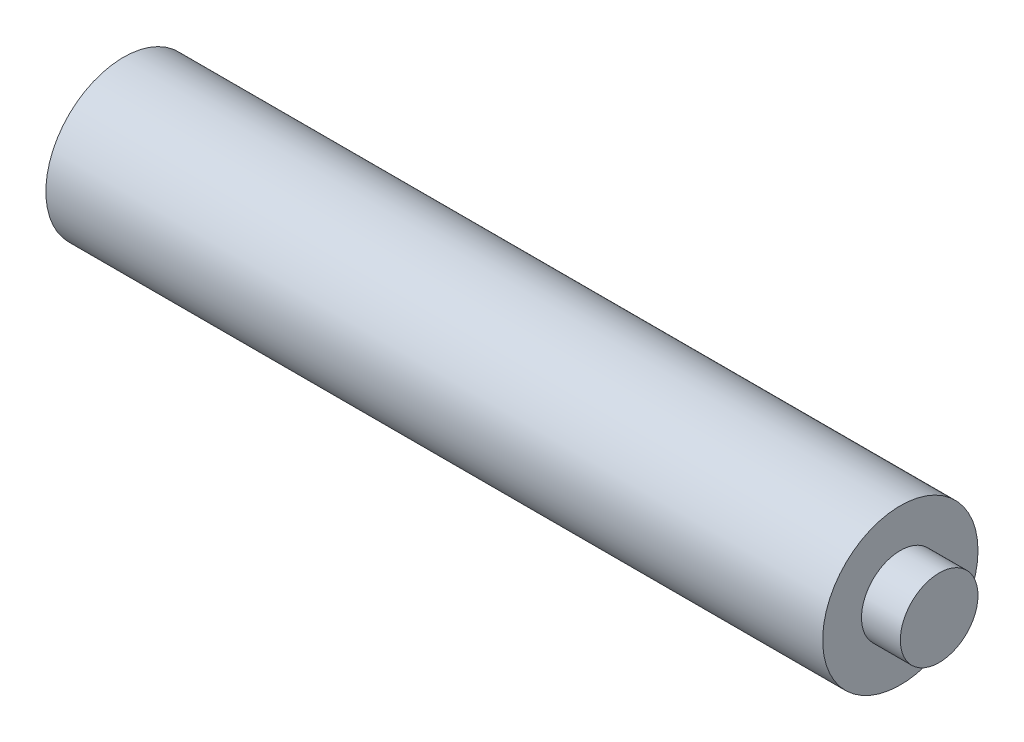
from build123d import *

# Parameters (mm, degrees)
SKETCH1_R           = 4
BOSS_EXTRUDE1_DEPTH = 20
SKETCH2_R           = 2
BOSS_EXTRUDE2_DEPTH = 2


with BuildPart() as part:
    # Sketch1 → Boss-Extrude1 (new, symmetric)
    with BuildSketch(Plane(origin=(0, 0, 0), x_dir=(0, 0, -1), z_dir=(1, 0, 0))):
        Circle(SKETCH1_R)
    extrude(amount=BOSS_EXTRUDE1_DEPTH, both=True)

    # Sketch2 → Boss-Extrude2 (add)
    with BuildSketch(Plane(origin=(20, 0, 0), x_dir=(0, 0, -1), z_dir=(1, 0, 0))):
        Circle(SKETCH2_R)
    extrude(amount=BOSS_EXTRUDE2_DEPTH)


solid = part.part
